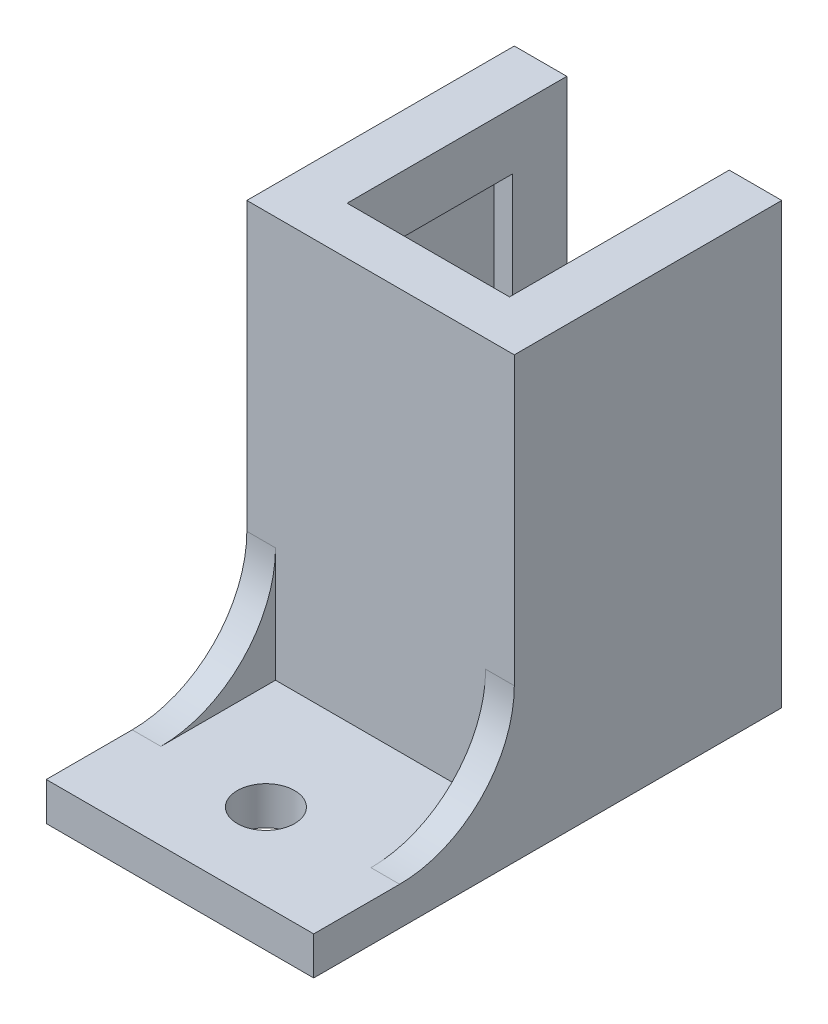
from build123d import *

# Parameters (mm, degrees)
SKETCH1_W           = 14
SKETCH1_H           = 23
BOSS_EXTRUDE1_DEPTH = 14
CUT_EXTRUDE1_DEPTH  = 20
SKETCH3_W           = 14
SKETCH3_H           = 10.5
SKETCH3_R           = 1.5
BOSS_EXTRUDE2_DEPTH = 2
BOSS_EXTRUDE3_DEPTH = 1.5
SKETCH5_W           = 8.5
SKETCH5_H           = 11.5
CUT_EXTRUDE2_DEPTH  = 33.392128673


with BuildPart() as part:
    # Sketch1 → Boss-Extrude1 (new body)
    with BuildSketch(Plane.XY):
        Rectangle(SKETCH1_W, SKETCH1_H)
    extrude(amount=BOSS_EXTRUDE1_DEPTH)

    # Sketch2 → Cut-Extrude1 (cut)
    with BuildSketch(Plane.XZ.offset(11.5)):
        Polygon((4.25, 2.85), (5.2, 2.85), (5.2, 11.5), (-5.2, 11.5), (-5.2, 2.85), (-4.25, 2.85), (-4.25, 0), (4.25, 0), align=None)
    extrude(amount=-CUT_EXTRUDE1_DEPTH, mode=Mode.SUBTRACT)

    # Sketch3 → Boss-Extrude2 (add)
    with BuildSketch(Plane.XZ.offset(11.5)):
        with Locations((0, 19.25)):
            Rectangle(SKETCH3_W, SKETCH3_H)
        with Locations((0, 20)):
            Circle(SKETCH3_R, mode=Mode.SUBTRACT)
    extrude(amount=-BOSS_EXTRUDE2_DEPTH)

    # Sketch4 → Boss-Extrude3 (add)
    with BuildSketch(Plane.ZY.offset(7)):
        with BuildLine():
            Line((14, -3.5), (14, -9.5))
            Line((14, -9.5), (20, -9.5))
            ThreePointArc((20, -9.5), (15.757359313, -7.742640687), (14, -3.5))
        make_face()
    boss_extrude3 = extrude(amount=-BOSS_EXTRUDE3_DEPTH)

    # Mirror1: Boss-Extrude3 across plane
    add(boss_extrude3.mirror(Plane(origin=(0, 0, 0), x_dir=(0, 0, 1), z_dir=(1, 0, 0))))

    # Sketch5 → Cut-Extrude2 (cut, through all)
    with BuildSketch(Plane.XZ.offset(-8.5)):
        with Locations((0, 5.75)):
            Rectangle(SKETCH5_W, SKETCH5_H)
    extrude(amount=-CUT_EXTRUDE2_DEPTH, mode=Mode.SUBTRACT)


solid = part.part
